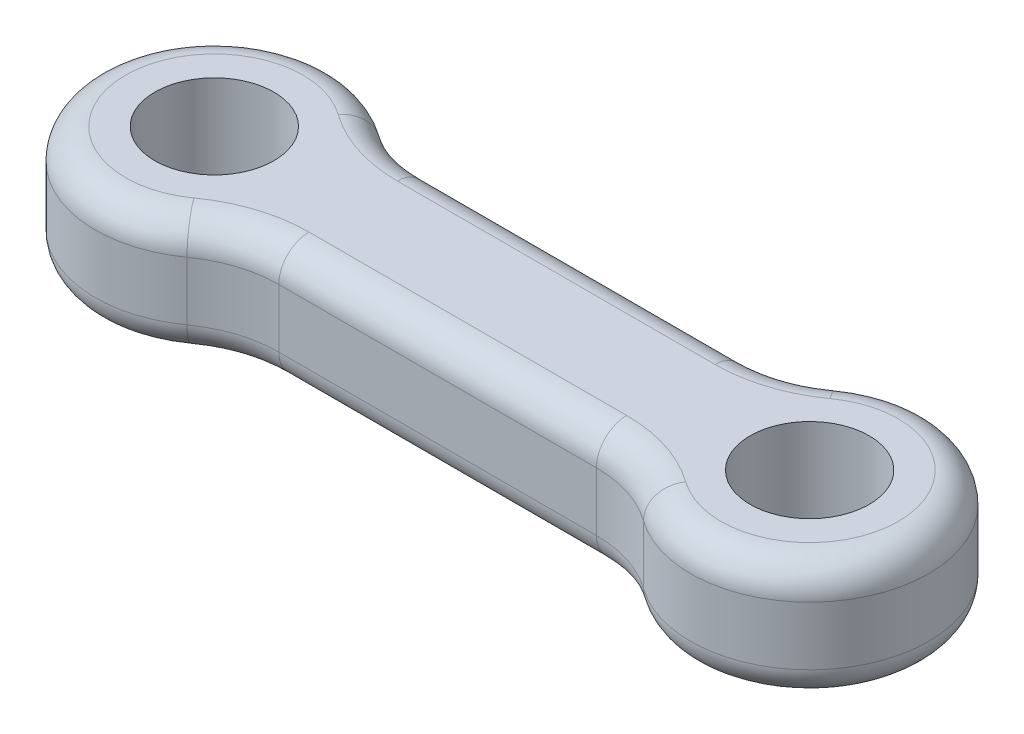
from build123d import *

# Parameters (mm, degrees)
SKETCH1_R           = 5
BOSS_EXTRUDE1_DEPTH = 10
FILLET1_R           = 2.54
SCALE1_SCALE        = 0.66


with BuildPart() as part:
    # Sketch1 → Boss-Extrude1 (new body)
    with BuildSketch(Plane(origin=(0, 0, 0), x_dir=(1, 0, 0), z_dir=(0, 1, 0))):
        with BuildLine():
            Line((-0.840776184, -6.25), (25.840776184, -6.25))
            ThreePointArc((25.840776184, -6.25), (28.902638362, -6.730283618), (31.670388092, -8.125))
            ThreePointArc((31.670388092, -8.125), (47.5, 0), (31.670388092, 8.125))
            ThreePointArc((31.670388092, 8.125), (28.902638362, 6.730283618), (25.840776184, 6.25))
            Line((25.840776184, 6.25), (-0.840776184, 6.25))
            ThreePointArc((-0.840776184, 6.25), (-3.902638362, 6.730283618), (-6.670388092, 8.125))
            ThreePointArc((-6.670388092, 8.125), (-22.5, 0), (-6.670388092, -8.125))
            ThreePointArc((-6.670388092, -8.125), (-3.902638362, -6.730283618), (-0.840776184, -6.25))
        make_face()
        with Locations((-12.5, 0)):
            Circle(SKETCH1_R, mode=Mode.SUBTRACT)
        with Locations((37.5, 0)):
            Circle(SKETCH1_R, mode=Mode.SUBTRACT)
    extrude(amount=BOSS_EXTRUDE1_DEPTH)

    # Fillet1
    fillet1_edges = [part.edges().sort_by_distance(p)[0] for p in [
        (-22.5, 0, 0),
        (-3.902638362, 0, 6.730283618),
        (12.5, 0, 6.25),
        (28.902638362, 0, 6.730283618),
        (47.5, 0, 0),
        (28.902638362, 0, -6.730283618),
        (12.5, 0, -6.25),
        (-3.902638362, 0, -6.730283618),
        (12.5, 10, -6.25),
        (28.902638362, 10, -6.730283618),
        (47.5, 10, 0),
        (28.902638362, 10, 6.730283618),
        (12.5, 10, 6.25),
        (-3.902638362, 10, 6.730283618),
        (-22.5, 10, 0),
        (-3.902638362, 10, -6.730283618),
    ]]
    fillet(fillet1_edges, radius=FILLET1_R)


with BuildPart() as part_1:
    # Scale1: scaled about (12.5, 5, 0)
    add(part.part.scale(SCALE1_SCALE).moved(Location((4.25, 1.7, 0))))


solid = part_1.part
